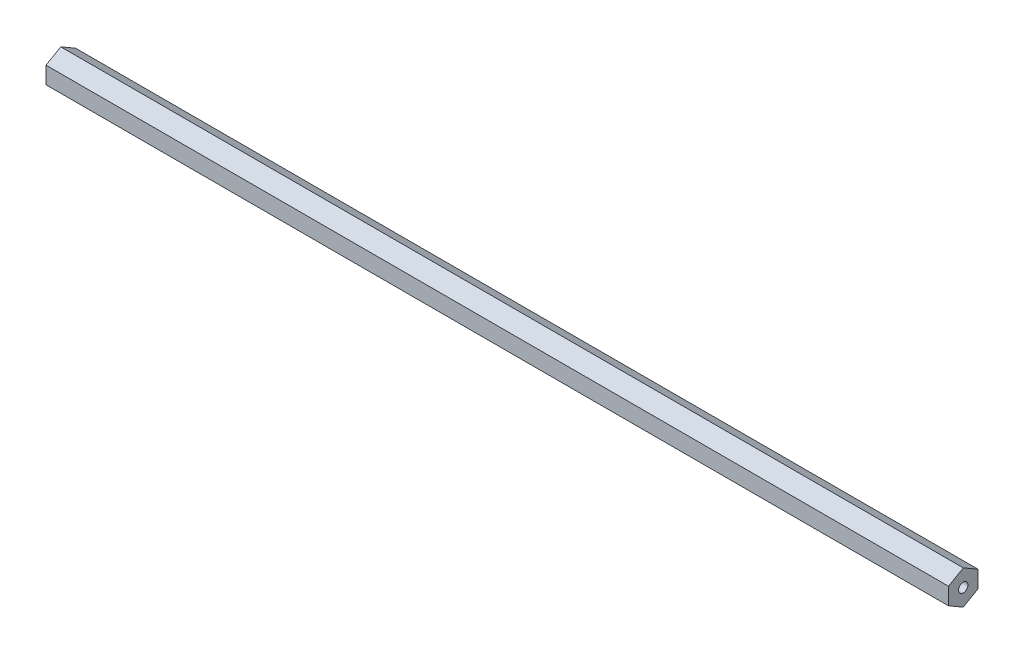
from build123d import *

# Parameters (mm, degrees)
BOSS_EXTRUDE1_DEPTH                  = 194.437
F_10_32_TAPPED_HOLE1_D               = 4.0386
F_10_32_TAPPED_HOLE1_DEPTH           = 16.34744
F_10_32_TAPPED_HOLE1_TIP             = 1.213317848
F_10_32_TAPPED_HOLE1_ON_FACE_2_D     = 4.0386
F_10_32_TAPPED_HOLE1_ON_FACE_2_DEPTH = 16.34744
F_10_32_TAPPED_HOLE1_ON_FACE_2_TIP   = 1.213317848


with BuildPart() as part:
    # Sketch1 → Boss-Extrude1 (new, symmetric)
    with BuildSketch(Plane(origin=(0, 0, 0), x_dir=(0, 0, -1), z_dir=(1, 0, 0))):
        Polygon((6.35, 3.666174209), (0, 7.332348419), (-6.35, 3.666174209), (-6.35, -3.666174209), (0, -7.332348419), (6.35, -3.666174209), align=None)
    extrude(amount=BOSS_EXTRUDE1_DEPTH, both=True)

    # #10-32 Tapped Hole1
    with Locations(Plane(origin=(194.437, 0, 0), x_dir=(0, 0, 1), z_dir=(1, 0, 0))):
        with Locations((0, 0)):
            Hole(F_10_32_TAPPED_HOLE1_D / 2, depth=F_10_32_TAPPED_HOLE1_DEPTH)
            with Locations((0, 0, -(F_10_32_TAPPED_HOLE1_DEPTH + F_10_32_TAPPED_HOLE1_TIP / 2))):  # 118° drill point
                Cone(0, F_10_32_TAPPED_HOLE1_D / 2, F_10_32_TAPPED_HOLE1_TIP, mode=Mode.SUBTRACT)

    # #10-32 Tapped Hole1 on face 2
    with Locations(Plane(origin=(-194.437, 0, 0), x_dir=(0, 0, -1), z_dir=(-1, 0, 0))):
        with Locations((0, 0)):
            Hole(F_10_32_TAPPED_HOLE1_ON_FACE_2_D / 2, depth=F_10_32_TAPPED_HOLE1_ON_FACE_2_DEPTH)
            with Locations((0, 0, -(F_10_32_TAPPED_HOLE1_ON_FACE_2_DEPTH + F_10_32_TAPPED_HOLE1_ON_FACE_2_TIP / 2))):  # 118° drill point
                Cone(0, F_10_32_TAPPED_HOLE1_ON_FACE_2_D / 2, F_10_32_TAPPED_HOLE1_ON_FACE_2_TIP, mode=Mode.SUBTRACT)


solid = part.part
